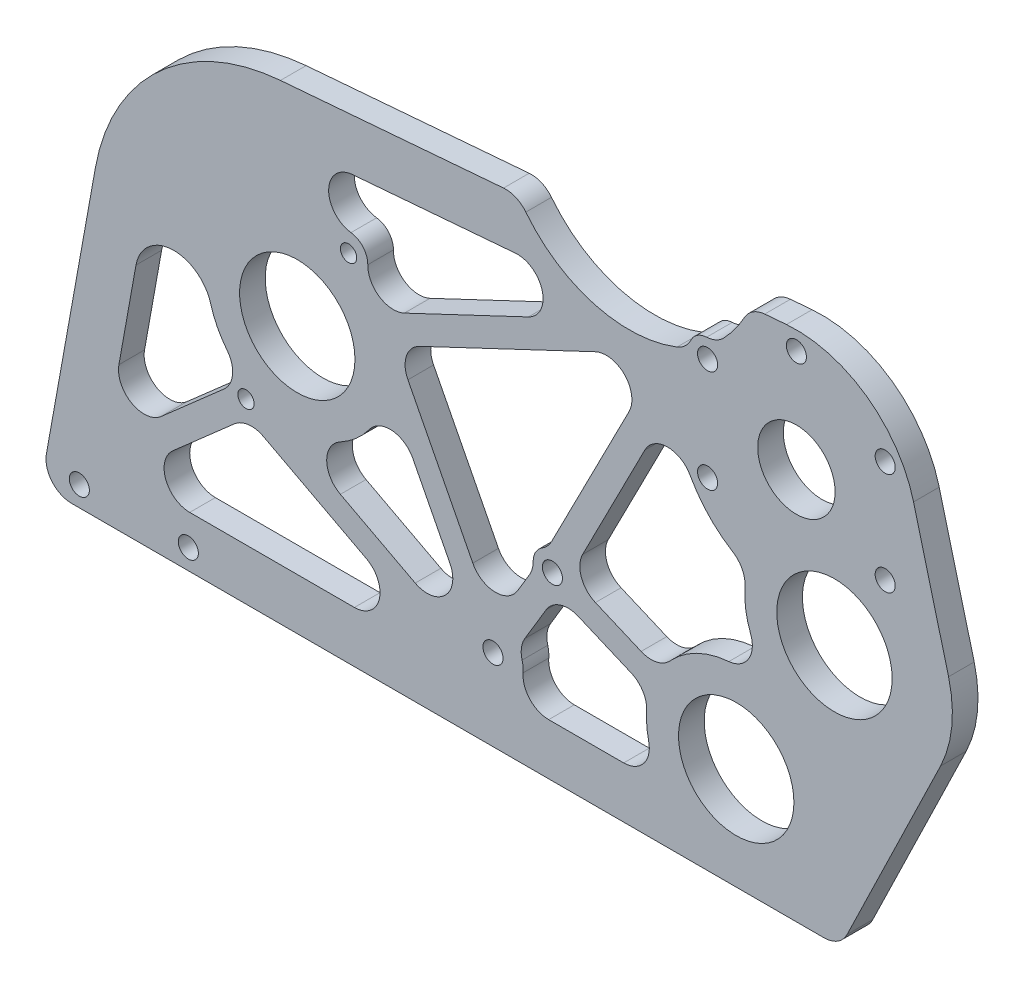
from build123d import *

# Parameters (mm, degrees)
SKETCH7_R           = 2.4892
SKETCH7_R_2         = 14.2875
SKETCH7_R_3         = 9.5885
BOSS_EXTRUDE1_DEPTH = 6.35
FILLET1_R           = 6.35
SKETCH8_R           = 2.0193
CUT_EXTRUDE1_DEPTH  = 423.42202378
CUT_EXTRUDE2_DEPTH  = 423.42202378
FILLET2_R           = 6.35
CUT_EXTRUDE3_DEPTH  = 423.422023923
FILLET3_R           = 6.35


with BuildPart() as part:
    # Sketch7 → Boss-Extrude1 (new body)
    with BuildSketch(Plane.XY):
        with BuildLine():
            Line((148.236473073, 271.355092857), (273.564102719, 281.661518102))
            ThreePointArc((273.564102719, 281.661518102), (293.369579348, 276.238056201), (305.046216096, 259.346431124))
            Line((305.046216096, 259.346431124), (313.710213478, 226.178385499))
            ThreePointArc((313.710213478, 226.178385499), (314.518022723, 215.934709796), (311.728513814, 206.045114875))
            Line((311.728513814, 206.045114875), (286.846396314, 154.7622))
            Line((286.846396314, 154.7622), (88.913712344, 154.7622))
            Line((88.913712344, 154.7622), (102.403069007, 229.723049032))
            ThreePointArc((102.403069007, 229.723049032), (118.243806289, 258.329117307), (148.236473073, 271.355092857))
        make_face()
        with Locations((298.019710626, 239.06503877)):
            Circle(SKETCH7_R, mode=Mode.SUBTRACT)
        with Locations((298.019710626, 264.46503877)):
            Circle(SKETCH7_R, mode=Mode.SUBTRACT)
        with Locations((254.025620114, 264.46503877)):
            Circle(SKETCH7_R, mode=Mode.SUBTRACT)
        with Locations((215.588385064, 199.44728721)):
            Circle(SKETCH7_R, mode=Mode.SUBTRACT)
        with Locations((200.87775722, 174.949776042)):
            Circle(SKETCH7_R, mode=Mode.SUBTRACT)
        with Locations((125.4125, 159.766)):
            Circle(SKETCH7_R, mode=Mode.SUBTRACT)
        with Locations((98.425, 159.766)):
            Circle(SKETCH7_R, mode=Mode.SUBTRACT)
        with Locations((261.120439119, 180.086)):
            Circle(SKETCH7_R_2, mode=Mode.SUBTRACT)
        with Locations((276.02266537, 251.76503877)):
            Circle(SKETCH7_R_3, mode=Mode.SUBTRACT)
        with Locations((152.4, 220.726)):
            Circle(SKETCH7_R_2, mode=Mode.SUBTRACT)
        with Locations((276.02266537, 277.16503877)):
            Circle(SKETCH7_R, mode=Mode.SUBTRACT)
        with Locations((254.025620114, 239.06503877)):
            Circle(SKETCH7_R, mode=Mode.SUBTRACT)
        with Locations((285.448500239, 218.795996669)):
            Circle(SKETCH7_R_2, mode=Mode.SUBTRACT)
    extrude(amount=BOSS_EXTRUDE1_DEPTH)

    # Fillet1
    fillet1_edges = [part.edges().sort_by_distance(p)[0] for p in [
        (88.913712344, 154.7622, 3.175),
        (286.846396314, 154.7622, 3.175),
    ]]
    fillet(fillet1_edges, radius=FILLET1_R)

    # Sketch8 → Cut-Extrude1 (cut, through all)
    with BuildSketch(Plane.XY.offset(6.35)):
        with Locations((139.7, 198.728954744)):
            Circle(SKETCH8_R)
        with Locations((165.1, 242.723045256)):
            Circle(SKETCH8_R)
    extrude(amount=-CUT_EXTRUDE1_DEPTH, mode=Mode.SUBTRACT)

    # Sketch9 → Cut-Extrude2 (cut, through all)
    with BuildSketch(Plane.XY.offset(6.35)):
        Polygon((192.215699939, 167.4622), (140.153176876, 194.901142091), (108.914200542, 167.4622), align=None)
        with BuildLine():
            Line((105.006311995, 172.481409229), (139.405190931, 202.695870709))
            ThreePointArc((139.405190931, 202.695870709), (134.178706704, 208.000627879), (130.997954718, 214.734081882))
            ThreePointArc((130.997954718, 214.734081882), (121.373696789, 221.680388553), (112.451225035, 213.853063668))
            Line((112.451225035, 213.853063668), (105.006311995, 172.481409229))
        make_face()
        with BuildLine():
            Line((142.856634161, 200.654258833), (199.416424943, 170.845084544))
            Line((199.416424943, 170.845084544), (174.574061505, 219.222131199))
            ThreePointArc((174.574061505, 219.222131199), (163.628316405, 201.545918256), (142.856634161, 200.654258833))
        make_face()
        with BuildLine():
            ThreePointArc((207.090659293, 179.1287284), (207.486615614, 171.430289472), (200.87775722, 167.4622))
            Line((200.87775722, 167.4622), (242.828629516, 167.4622))
            ThreePointArc((242.828629516, 167.4622), (239.225976426, 176.267213756), (239.635081351, 185.771949927))
            Line((239.635081351, 185.771949927), (216.888173338, 195.444463683))
            Line((216.888173338, 195.444463683), (207.090659293, 179.1287284))
        make_face()
        with BuildLine():
            Line((201.094517644, 181.478098076), (211.038996943, 198.038573623))
            ThreePointArc((211.038996943, 198.038573623), (211.425050763, 201.759873153), (214.380373796, 204.054033896))
            Line((214.380373796, 204.054033896), (243.097425101, 260.131834596))
            Line((243.097425101, 260.131834596), (176.811836963, 228.765240425))
            Line((176.811836963, 228.765240425), (201.094517644, 181.478098076))
        make_face()
        with BuildLine():
            Line((219.968480673, 201.034892152), (242.119929287, 191.615581567))
            ThreePointArc((242.119929287, 191.615581567), (249.429912668, 198.987910387), (259.290936082, 202.235572087))
            ThreePointArc((259.290936082, 202.235572087), (264.144609355, 205.185123877), (264.697171886, 210.837793569))
            ThreePointArc((264.697171886, 210.837793569), (263.260324006, 217.517145445), (263.920256051, 224.317348604))
            ThreePointArc((263.920256051, 224.317348604), (250.852304164, 235.446432103), (246.025658275, 251.91857087))
            Line((246.025658275, 251.91857087), (219.968480673, 201.034892152))
        make_face()
        with BuildLine():
            Line((241.195198828, 266.256762477), (166.000020107, 260.073022384))
            ThreePointArc((166.000020107, 260.073022384), (160.172149611, 253.890819557), (165.708768989, 247.446476908))
            ThreePointArc((165.708768989, 247.446476908), (168.703403325, 245.837028353), (169.861788631, 242.640733163))
            ThreePointArc((169.861788631, 242.640733163), (172.767890375, 237.195386558), (178.926936225, 236.791182135))
            Line((178.926936225, 236.791182135), (241.195198828, 266.256762477))
        make_face()
    extrude(amount=-CUT_EXTRUDE2_DEPTH, mode=Mode.SUBTRACT)

    # Fillet2
    fillet2_edges = [part.edges().sort_by_distance(p)[0] for p in [
        (211.038996943, 198.038573623, 3.175),
        (201.094517644, 181.478098076, 3.175),
        (176.811836963, 228.765240425, 3.175),
        (243.097425101, 260.131834596, 3.175),
        (214.380373796, 204.054033896, 3.175),
        (174.574061505, 219.222131199, 3.175),
        (199.416424943, 170.845084544, 3.175),
        (142.856634161, 200.654258833, 3.175),
        (242.828629516, 167.4622, 3.175),
        (200.87775722, 167.4622, 3.175),
        (207.090659293, 179.1287284, 3.175),
        (216.888173338, 195.444463683, 3.175),
        (239.635081351, 185.771949927, 3.175),
        (192.215699939, 167.4622, 3.175),
        (108.914200542, 167.4622, 3.175),
        (140.153176876, 194.901142091, 3.175),
        (242.119929287, 191.615581567, 3.175),
        (219.968480673, 201.034892152, 3.175),
        (246.025658275, 251.91857087, 3.175),
        (263.920256051, 224.317348604, 3.175),
        (139.405190931, 202.695870709, 3.175),
        (241.195198828, 266.256762477, 3.175),
        (105.006311995, 172.481409229, 3.175),
    ]]
    fillet(fillet2_edges, radius=FILLET2_R)

    # Sketch10 → Cut-Extrude3 (cut, through all)
    with BuildSketch(Plane.XY.offset(6.35)):
        with BuildLine():
            Line((264.583532566, 280.922993203), (207.100835973, 276.195854288))
            ThreePointArc((207.100835973, 276.195854288), (226.020882796, 262.199028236), (249.430792967, 264.618825149))
            ThreePointArc((249.430792967, 264.618825149), (251.475179127, 268.29013191), (255.65031485, 268.765789143))
            ThreePointArc((255.65031485, 268.765789143), (260.831118247, 274.319594906), (264.583532566, 280.922993203))
        make_face()
    extrude(amount=-CUT_EXTRUDE3_DEPTH, mode=Mode.SUBTRACT)

    # Fillet3
    fillet3_edges = [part.edges().sort_by_distance(p)[0] for p in [
        (207.100835973, 276.195854288, 3.175),
        (249.430792967, 264.618825149, 3.175),
        (255.65031485, 268.765789143, 3.175),
        (264.583532566, 280.922993203, 3.175),
    ]]
    fillet(fillet3_edges, radius=FILLET3_R)


solid = part.part
